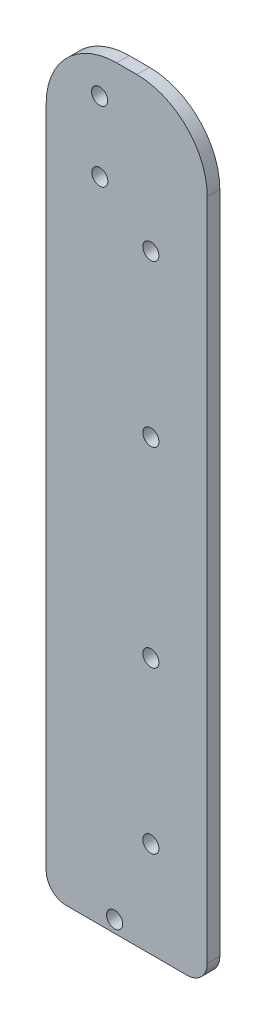
from build123d import *

# Parameters (mm, degrees)
SKETCH1_R           = 2.032
BOSS_EXTRUDE2_DEPTH = 3.175


with BuildPart() as part:
    # Sketch1 → Boss-Extrude2 (new body)
    with BuildSketch(Plane.XY):
        with BuildLine():
            Line((40.64, 5.08), (40.64, 172.72))
            ThreePointArc((40.64, 172.72), (35.432358569, 185.292358569), (22.86, 190.5))
            Line((22.86, 190.5), (17.78, 190.5))
            ThreePointArc((17.78, 190.5), (5.207641431, 185.292358569), (0, 172.72))
            Line((0, 172.72), (0, 5.08))
            ThreePointArc((0, 5.08), (1.487897552, 1.487897552), (5.08, 0))
            Line((5.08, 0), (26.416, 0))
            Line((26.416, 0), (35.56, 0))
            ThreePointArc((35.56, 0), (39.152102448, 1.487897552), (40.64, 5.08))
        make_face()
        with Locations((26.416, 24.13)):
            Circle(SKETCH1_R, mode=Mode.SUBTRACT)
        with Locations((26.416, 64.77)):
            Circle(SKETCH1_R, mode=Mode.SUBTRACT)
        with Locations((26.416, 113.03)):
            Circle(SKETCH1_R, mode=Mode.SUBTRACT)
        with Locations((26.416, 153.67)):
            Circle(SKETCH1_R, mode=Mode.SUBTRACT)
        with Locations((17.272, 3.048)):
            Circle(SKETCH1_R, mode=Mode.SUBTRACT)
        with Locations((13.492529792, 181.102)):
            Circle(SKETCH1_R, mode=Mode.SUBTRACT)
        with Locations((13.531045562, 163.449)):
            Circle(SKETCH1_R, mode=Mode.SUBTRACT)
    extrude(amount=BOSS_EXTRUDE2_DEPTH)


solid = part.part
